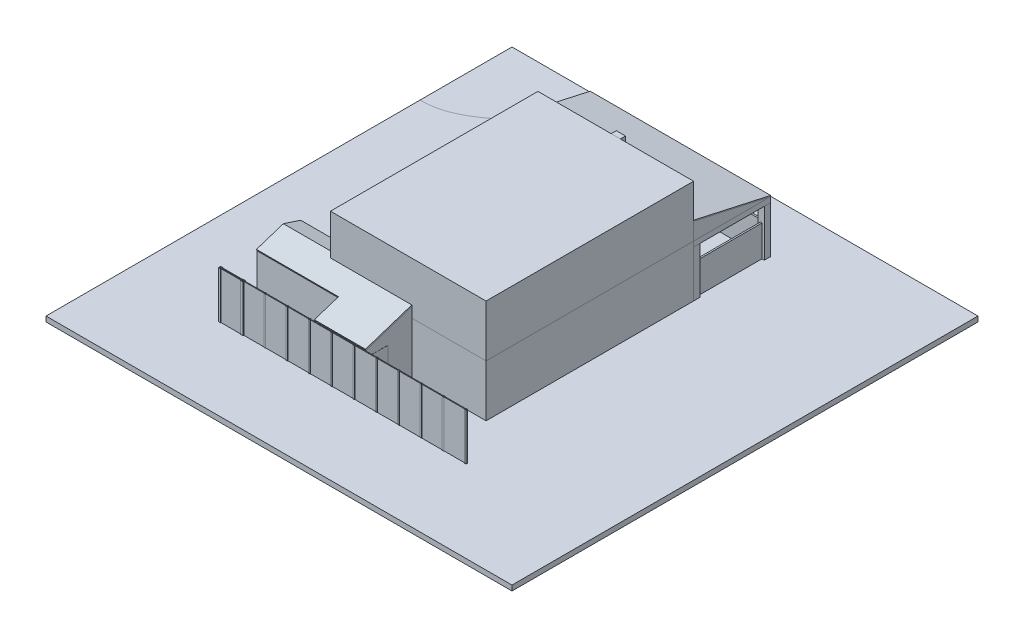
from build123d import *

# Parameters (mm, degrees)
SKETCH1_W                        = 15000
SKETCH1_H                        = 20000
BOSS_EXTRUDE1_DEPTH              = 5000
SKETCH18_W                       = 15000
SKETCH18_H                       = 20000
BOSS_EXTRUDE17_DEPTH             = 5000
BOSS_EXTRUDE23_DEPTH             = 500
EXTRUDE_THIN1_DEPTH              = 4500
EXTRUDE_THIN1_2_DEPTH            = 4500
SKETCH13_W                       = 44914.669786522
SKETCH13_H                       = 44914.669786522
BOSS_EXTRUDE15_DEPTH             = 500
BOSS_EXTRUDE16_DEPTH             = 500
CUT_EXTRUDE2_DEPTH               = 500
SKETCH19_W                       = 600
SKETCH19_H                       = 600
BOSS_EXTRUDE18_DEPTH             = 4500
BOSS_EXTRUDE18_2_DEPTH           = 4500
BOSS_EXTRUDE18_3_DEPTH           = 4500
BOSS_EXTRUDE18_4_DEPTH           = 4500
BOSS_EXTRUDE18_5_DEPTH           = 4500
BOSS_EXTRUDE18_6_DEPTH           = 4500
SKETCH25_W                       = 5000
SKETCH25_H                       = 150
BOSS_EXTRUDE24_DEPTH             = 3000
BOSS_EXTRUDE24_2_DEPTH           = 3000
BOSS_EXTRUDE24_3_DEPTH           = 3000
SKETCH25_W_2                     = 150
SKETCH25_H_2                     = 6215.075908171
BOSS_EXTRUDE24_4_DEPTH           = 3000
BOSS_EXTRUDE19_DEPTH             = 500
BOSS_EXTRUDE20_REACH             = 33298.603
BOSS_EXTRUDE20_DIRECTION_2_REACH = 33298.603
BOSS_EXTRUDE22_DEPTH             = 100
BOSS_EXTRUDE25_DEPTH             = 4500
BOSS_EXTRUDE26_DEPTH             = 4923.896568432
BOSS_EXTRUDE27_DEPTH             = 2920.430143306
BOSS_EXTRUDE28_DEPTH             = 4982.302916929
BOSS_EXTRUDE31_REACH             = 32234.185
SKETCH31_W                       = 200
SKETCH31_H                       = 4425
BOSS_EXTRUDE32_REACH             = 32234.185
BOSS_EXTRUDE33_DEPTH             = 10
BOSS_EXTRUDE33_DEPTH_BACK        = 210
SKETCH33_W                       = 1629.168946947
SKETCH33_H                       = 3889.531779121
SKETCH34_W                       = 1916.861309311
SKETCH34_H                       = 1466.865342486
CUT_EXTRUDE3_DEPTH               = 341


# Read off the part's stored shape, not the designer's step: Extrude-Thin1
with BuildPart() as part:
    # Sketch1 → Boss-Extrude1 (new body)
    with BuildSketch(Plane(origin=(0, 0, 0), x_dir=(1, 0, 0), z_dir=(0, 1, 0))):
        Rectangle(SKETCH1_W, SKETCH1_H)
    extrude(amount=BOSS_EXTRUDE1_DEPTH)


with BuildPart() as body_2:
    # Sketch18 → Boss-Extrude17 (new body)
    with BuildSketch(Plane(origin=(0, 5000, 0), x_dir=(1, 0, 0), z_dir=(0, 1, 0))):
        Rectangle(SKETCH18_W, SKETCH18_H)
    extrude(amount=BOSS_EXTRUDE17_DEPTH)



with BuildPart() as body_3:
    # Sketch24 → Boss-Extrude23 (new body)
    with BuildSketch(Plane(origin=(0, 0, -10000), x_dir=(-1, 0, 0), z_dir=(0, 0, -1))):
        Polygon((-1037.06837073, 0), (1037.06837073, 0), (1037.06837073, 5000), (443.459320269, 5593.609050461), (443.459320269, 10000), (-443.459320269, 10000), (-443.459320269, 5593.609050461), (-1037.06837073, 5000), align=None)
    extrude(amount=BOSS_EXTRUDE23_DEPTH)


with BuildPart() as body_4:
    # Extrude-Thin1 outline → Extrude-Thin1 (new body)
    with BuildSketch(Plane(origin=(0, 0, 0), x_dir=(1, 0, 0), z_dir=(0, 1, 0))):
        Polygon((-9350, -14462.5), (-11350, -14462.5), (-11350, -14498), (-9314.5, -14498), (-9314.5, -14460.5), (-9235.5, -14460.5), (-9235.5, -14498), (-7164.5, -14498), (-7164.5, -14460.5), (-7085.5, -14460.5), (-7085.5, -14498), (-5014.5, -14498), (-5014.5, -14460.5), (-4935.5, -14460.5), (-4935.5, -14498), (-2864.5, -14498), (-2864.5, -14460.5), (-2785.5, -14460.5), (-2785.5, -14498), (-714.5, -14498), (-714.5, -14460.5), (-635.5, -14460.5), (-635.5, -14498), (1435.5, -14498), (1435.5, -14460.5), (1514.5, -14460.5), (1514.5, -14498), (3585.5, -14498), (3585.5, -14460.5), (3664.5, -14460.5), (3664.5, -14498), (5735.5, -14498), (5735.5, -14460.5), (5814.5, -14460.5), (5814.5, -14498), (7885.5, -14498), (7885.5, -14460.5), (7964.5, -14460.5), (7964.5, -14498), (10035.5, -14498), (10035.5, -14460.5), (10114.5, -14460.5), (10114.5, -14539.5), (10035.5, -14539.5), (10035.5, -14502), (7964.5, -14502), (7964.5, -14539.5), (7885.5, -14539.5), (7885.5, -14502), (5814.5, -14502), (5814.5, -14539.5), (5735.5, -14539.5), (5735.5, -14502), (3664.5, -14502), (3664.5, -14539.5), (3585.5, -14539.5), (3585.5, -14502), (1514.5, -14502), (1514.5, -14539.5), (1435.5, -14539.5), (1435.5, -14502), (-635.5, -14502), (-635.5, -14539.5), (-714.5, -14539.5), (-714.5, -14502), (-2785.5, -14502), (-2785.5, -14539.5), (-2864.5, -14539.5), (-2864.5, -14502), (-4935.5, -14502), (-4935.5, -14539.5), (-5014.5, -14539.5), (-5014.5, -14502), (-7085.5, -14502), (-7085.5, -14539.5), (-7164.5, -14539.5), (-7164.5, -14502), (-9235.5, -14502), (-9235.5, -14539.5), (-9314.5, -14539.5), (-9314.5, -14502), (-11350, -14502), (-11350, -14537.5), (-9350, -14537.5), (-9350, -14575), (-9200, -14575), (-9200, -14537.5), (-7200, -14537.5), (-7200, -14575), (-7050, -14575), (-7050, -14537.5), (-5050, -14537.5), (-5050, -14575), (-4900, -14575), (-4900, -14537.5), (-2900, -14537.5), (-2900, -14575), (-2750, -14575), (-2750, -14537.5), (-750, -14537.5), (-750, -14575), (-600, -14575), (-600, -14537.5), (1400, -14537.5), (1400, -14575), (1550, -14575), (1550, -14537.5), (3550, -14537.5), (3550, -14575), (3700, -14575), (3700, -14537.5), (5700, -14537.5), (5700, -14575), (5850, -14575), (5850, -14537.5), (7850, -14537.5), (7850, -14575), (8000, -14575), (8000, -14537.5), (10000, -14537.5), (10000, -14575), (10150, -14575), (10150, -14425), (10000, -14425), (10000, -14462.5), (8000, -14462.5), (8000, -14425), (7850, -14425), (7850, -14462.5), (5850, -14462.5), (5850, -14425), (5700, -14425), (5700, -14462.5), (3700, -14462.5), (3700, -14425), (3550, -14425), (3550, -14462.5), (1550, -14462.5), (1550, -14425), (1400, -14425), (1400, -14462.5), (-600, -14462.5), (-600, -14425), (-750, -14425), (-750, -14462.5), (-2750, -14462.5), (-2750, -14425), (-2900, -14425), (-2900, -14462.5), (-4900, -14462.5), (-4900, -14425), (-5050, -14425), (-5050, -14462.5), (-7050, -14462.5), (-7050, -14425), (-7200, -14425), (-7200, -14462.5), (-9200, -14462.5), (-9200, -14425), (-9350, -14425), align=None)
    extrude(amount=EXTRUDE_THIN1_DEPTH)


with BuildPart() as body_5:
    # Extrude-Thin1 2 outline → Extrude-Thin1 2 (new body)
    with BuildSketch(Plane(origin=(0, 0, 0), x_dir=(1, 0, 0), z_dir=(0, 1, 0))):
        Polygon((-11350, -14425), (-11350, -14462.5), (-11314.5, -14462.5), (-11314.5, -14389.5), (-11535.5, -14389.5), (-11535.5, -14427), (-13464.5, -14427), (-13464.5, -14389.5), (-13685.5, -14389.5), (-13685.5, -14610.5), (-13464.5, -14610.5), (-13464.5, -14573), (-11535.5, -14573), (-11535.5, -14610.5), (-11314.5, -14610.5), (-11314.5, -14537.5), (-11350, -14537.5), (-11350, -14575), (-11500, -14575), (-11500, -14537.5), (-13500, -14537.5), (-13500, -14575), (-13650, -14575), (-13650, -14425), (-13500, -14425), (-13500, -14462.5), (-11500, -14462.5), (-11500, -14425), align=None)
    extrude(amount=EXTRUDE_THIN1_2_DEPTH)


with BuildPart() as body_6:
    # Sketch13 → Boss-Extrude15 (new body)
    with BuildSketch(Plane(origin=(0, 0, 0), x_dir=(1, 0, 0), z_dir=(0, 1, 0))):
        Rectangle(SKETCH13_W, SKETCH13_H)
    extrude(amount=-BOSS_EXTRUDE15_DEPTH)

    # Sketch17 → Cut-Extrude2 (cut)
    with BuildSketch(Plane(origin=(0, 0, 0), x_dir=(1, 0, 0), z_dir=(0, 1, 0))):
        with BuildLine():
            Line((-9417.596595329, 19912.914486274), (253.16202151, 19912.914486274))
            Line((253.16202151, 19912.914486274), (253.16202151, 22457.334893261))
            Line((253.16202151, 22457.334893261), (-22457.334893261, 22457.334893261))
            Line((-22457.334893261, 22457.334893261), (-22457.334893261, 13580.491726715))
            add(Edge.make_bspline(
                [(-22457.334893261, 13580.491726715), (-17070.908883704, 13536.391631527), (-14927.238931581, 19847.930276605), (-9417.596595329, 19912.914486274)],
                knots=[0, 0, 0, 0, 1, 1, 1, 1], degree=3))
        make_face()
    extrude(amount=-CUT_EXTRUDE2_DEPTH, mode=Mode.SUBTRACT)


with BuildPart() as body_7:
    # Sketch15 → Boss-Extrude16 (new body)
    with BuildSketch(Plane(origin=(0, 0, 0), x_dir=(1, 0, 0), z_dir=(0, 1, 0))):
        with BuildLine():
            Line((-22457.334893261, 13580.491726715), (-22457.334893261, 22457.334893261))
            Line((-22457.334893261, 22457.334893261), (253.16202151, 22457.334893261))
            Line((253.16202151, 22457.334893261), (253.16202151, 19912.914486274))
            Line((253.16202151, 19912.914486274), (-9417.596595329, 19912.914486274))
            add(Edge.make_bspline(
                [(-22457.334893261, 13580.491726715), (-17070.908883704, 13536.391631527), (-14927.238931581, 19847.930276605), (-9417.596595329, 19912.914486274)],
                knots=[0, 0, 0, 0, 1, 1, 1, 1], degree=3))
        make_face()
    extrude(amount=-BOSS_EXTRUDE16_DEPTH)


with BuildPart() as body_8:
    # Sketch19 → Boss-Extrude18 (new body)
    with BuildSketch(Plane(origin=(0, 0, 0), x_dir=(1, 0, 0), z_dir=(0, 1, 0))):
        with Locations((-9600, 10300)):
            Rectangle(SKETCH19_W, SKETCH19_H)
    extrude(amount=BOSS_EXTRUDE18_DEPTH)


with BuildPart() as body_9:
    # Sketch19 → Boss-Extrude18 2 (new body)
    with BuildSketch(Plane(origin=(0, 0, 0), x_dir=(1, 0, 0), z_dir=(0, 1, 0))):
        with Locations((-9600, 17115.075908171)):
            Rectangle(SKETCH19_W, SKETCH19_H)
    extrude(amount=BOSS_EXTRUDE18_2_DEPTH)


with BuildPart() as body_10:
    # Sketch19 → Boss-Extrude18 3 (new body)
    with BuildSketch(Plane(origin=(0, 0, 0), x_dir=(1, 0, 0), z_dir=(0, 1, 0))):
        with Locations((-4000, 17115.075908171)):
            Rectangle(SKETCH19_W, SKETCH19_H)
    extrude(amount=BOSS_EXTRUDE18_3_DEPTH)


with BuildPart() as body_11:
    # Sketch19 → Boss-Extrude18 4 (new body)
    with BuildSketch(Plane(origin=(0, 0, 0), x_dir=(1, 0, 0), z_dir=(0, 1, 0))):
        with Locations((1600, 17115.075908171)):
            Rectangle(SKETCH19_W, SKETCH19_H)
    extrude(amount=BOSS_EXTRUDE18_4_DEPTH)


with BuildPart() as body_12:
    # Sketch19 → Boss-Extrude18 5 (new body)
    with BuildSketch(Plane(origin=(0, 0, 0), x_dir=(1, 0, 0), z_dir=(0, 1, 0))):
        with Locations((7200, 17115.075908171)):
            Rectangle(SKETCH19_W, SKETCH19_H)
    extrude(amount=BOSS_EXTRUDE18_5_DEPTH)


with BuildPart() as body_13:
    # Sketch19 → Boss-Extrude18 6 (new body)
    with BuildSketch(Plane(origin=(0, 0, 0), x_dir=(1, 0, 0), z_dir=(0, 1, 0))):
        with Locations((7200, 10300)):
            Rectangle(SKETCH19_W, SKETCH19_H)
    extrude(amount=BOSS_EXTRUDE18_6_DEPTH)


with BuildPart() as body_14:
    # Sketch25 → Boss-Extrude24 (new body)
    with BuildSketch(Plane(origin=(0, 0, 0), x_dir=(1, 0, 0), z_dir=(0, 1, 0))):
        with Locations((-6800, 17115.075908171)):
            Rectangle(SKETCH25_W, SKETCH25_H)
    extrude(amount=BOSS_EXTRUDE24_DEPTH)


with BuildPart() as body_15:
    # Sketch25 → Boss-Extrude24 2 (new body)
    with BuildSketch(Plane(origin=(0, 0, 0), x_dir=(1, 0, 0), z_dir=(0, 1, 0))):
        with Locations((-1200, 17115.075908171)):
            Rectangle(SKETCH25_W, SKETCH25_H)
    extrude(amount=BOSS_EXTRUDE24_2_DEPTH)


with BuildPart() as body_16:
    # Sketch25 → Boss-Extrude24 3 (new body)
    with BuildSketch(Plane(origin=(0, 0, 0), x_dir=(1, 0, 0), z_dir=(0, 1, 0))):
        with Locations((4400, 17115.075908171)):
            Rectangle(SKETCH25_W, SKETCH25_H)
    extrude(amount=BOSS_EXTRUDE24_3_DEPTH)


with BuildPart() as body_17:
    # Sketch25 → Boss-Extrude24 4 (new body)
    with BuildSketch(Plane(origin=(0, 0, 0), x_dir=(1, 0, 0), z_dir=(0, 1, 0))):
        with Locations((7200, 13707.537954086)):
            Rectangle(SKETCH25_W_2, SKETCH25_H_2)
    extrude(amount=BOSS_EXTRUDE24_4_DEPTH)


with BuildPart() as body_18:
    # Sketch20 → Boss-Extrude19 (new body)
    with BuildSketch(Plane(origin=(0, 4500, 0), x_dir=(1, 0, 0), z_dir=(0, 1, 0))):
        Polygon((7500, 10000), (7500, 17415.075908171), (-9900, 17415.075908171), (-9900, 10000), (-1037.06837073, 10000), (-1037.06837073, 10500), (1037.06837073, 10500), (1037.06837073, 10000), align=None)
    extrude(amount=BOSS_EXTRUDE19_DEPTH)


with BuildPart() as body_19:

    # Boss-Extrude20: up to this face of the body (flat: up to its plane)
    boss_extrude20_end = Plane(body_18.part.faces().sort_by_distance((-9900, 4750, -13707.537954085))[0])
    # Sketch21 → Boss-Extrude20 (new, up to the picked face)
    with BuildSketch(Plane(origin=(0, 0, 0), x_dir=(0, 0, -1), z_dir=(1, 0, 0)), mode=Mode.PRIVATE) as boss_extrude20_sk1:
        Polygon((17415.075908171, 5000), (10000, 6643.882751934), (10000, 5000), align=None)
    boss_extrude20_tool1 = split(extrude(boss_extrude20_sk1.sketch, amount=-BOSS_EXTRUDE20_REACH, mode=Mode.PRIVATE), bisect_by=boss_extrude20_end, keep=Keep.BOTH, mode=Mode.PRIVATE)
    add(boss_extrude20_tool1.solids().sort_by(Axis((0, 5547.960917, -12471.691969), (-1, 0, 0)))[0])


    # Boss-Extrude20 direction 2: up to this face of the body (flat: up to its plane)
    boss_extrude20_direction_2_end = Plane(body_18.part.faces().sort_by_distance((7500, 4750, -13707.537954085))[0])
    # Sketch21 → Boss-Extrude20 direction 2 (add, up to the picked face)
    with BuildSketch(Plane(origin=(0, 0, 0), x_dir=(0, 0, -1), z_dir=(1, 0, 0)), mode=Mode.PRIVATE) as boss_extrude20_direction_2_sk1:
        Polygon((17415.075908171, 5000), (10000, 6643.882751934), (10000, 5000), align=None)
    boss_extrude20_direction_2_tool1 = split(extrude(boss_extrude20_direction_2_sk1.sketch, amount=BOSS_EXTRUDE20_DIRECTION_2_REACH, mode=Mode.PRIVATE), bisect_by=boss_extrude20_direction_2_end, keep=Keep.BOTH, mode=Mode.PRIVATE)
    add(boss_extrude20_direction_2_tool1.solids().sort_by(Axis((0, 5547.960917, -12471.691969), (1, 0, 0)))[0])


with BuildPart() as body_20:
    # Sketch23 → Boss-Extrude22 (new body)
    with BuildSketch(Plane(origin=(0, 8445.734021788, -1872.374154732), x_dir=(1, 0, 0), z_dir=(0, 0.9762960071199333, -0.21643961393810338))):
        Polygon((-9900, 15920.071003147), (7500, 15920.071003147), (7500, 8324.960653321), (443.459320269, 8324.960653321), (443.459320269, 8837.100410478), (-443.459320269, 8837.100410478), (-443.459320269, 8324.960653321), (-9900, 8324.960653321), align=None)
    extrude(amount=BOSS_EXTRUDE22_DEPTH)


with BuildPart() as body_21:
    # Sketch26 → Boss-Extrude25 (new body)
    with BuildSketch(Plane(origin=(0, 0, 0), x_dir=(1, 0, 0), z_dir=(0, 1, 0))):
        Polygon((-7500, -7928.527067686), (-7500, -8128.527067686), (-12282.302916929, -8128.527067686), (-12282.302916929, -11903.413636673), (-4379.569856694, -11903.413636673), (-4379.569856694, -14225), (144.326711738, -14225), (144.326711738, -10000), (344.326711738, -10000), (344.326711738, -14425), (-4579.569856694, -14425), (-4579.569856694, -12103.413636673), (-12482.302916929, -12103.413636673), (-12482.302916929, -7928.527067686), align=None)
    extrude(amount=BOSS_EXTRUDE25_DEPTH)



with BuildPart() as body_22:
    # Sketch27 → Boss-Extrude26 (new body)
    with BuildSketch(Plane(origin=(344.326711738, 0, 0), x_dir=(0, 0, -1), z_dir=(1, 0, 0))):
        Polygon((-14425, 4500), (-10000, 5947.185193665), (-10000, 6097.525015869), (-14469.417377488, 4635.813229878), align=None)
    extrude(amount=-BOSS_EXTRUDE26_DEPTH)

    # Sketch28 → Boss-Extrude27 (add)
    with BuildSketch(Plane.ZY.offset(4579.569856694)):
        Polygon((12103.413636673, 5259.269019395), (12147.831014161, 5395.082249272), (10000, 6097.525015869), (10000, 5947.185193665), align=None)
    extrude(amount=BOSS_EXTRUDE27_DEPTH)


with BuildPart() as body_2_1:
    add(body_2.part)

    add(body_22.part)  # Boss-Extrude28 merges body 22
    # Sketch30 → Boss-Extrude28 (add)
    with BuildSketch(Plane.ZY.offset(7500)):
        Polygon((7884.109690198, 5696.023932711), (9555.881707324, 6242.772793811), (12147.831014161, 5395.082249272), (12103.413636673, 5259.269019395), (9555.881707324, 6092.432971608), (7928.527067686, 5560.210702833), align=None)
    extrude(amount=BOSS_EXTRUDE28_DEPTH)


with BuildPart() as body_21_1:
    add(body_21.part)

    # Boss-Extrude31: up to this face of the body (flat: up to its plane)
    boss_extrude31_end = Plane(body_2_1.part.faces().sort_by_distance((-5170.734727105, 5422.3035037, 11604.909646854))[0])
    # Sketch31 → Boss-Extrude31 (add, up to the picked face)
    with BuildSketch(Plane(origin=(0, 4500, 0), x_dir=(1, 0, 0), z_dir=(0, 1, 0)), mode=Mode.PRIVATE) as boss_extrude31_sk1:
        with Locations((244.326711738, -12212.5)):
            Rectangle(SKETCH31_W, SKETCH31_H)
    boss_extrude31_tool1 = split(extrude(boss_extrude31_sk1.sketch, amount=BOSS_EXTRUDE31_REACH, mode=Mode.PRIVATE), bisect_by=boss_extrude31_end, keep=Keep.BOTH, mode=Mode.PRIVATE)
    # Sketch31 → Boss-Extrude31 (add, up to the picked face)
    with BuildSketch(Plane(origin=(0, 4500, 0), x_dir=(1, 0, 0), z_dir=(0, 1, 0)), mode=Mode.PRIVATE) as boss_extrude31_sk2:
        Polygon((-12482.302916929, -9555.881707324), (-12482.302916929, -12103.413636673), (-4579.569856694, -12103.413636673), (-4579.569856694, -14425), (-4379.569856694, -14425), (-4379.569856694, -11903.413636673), (-12282.302916929, -11903.413636673), (-12282.302916929, -9555.881707324), align=None)
    boss_extrude31_tool2 = split(extrude(boss_extrude31_sk2.sketch, amount=BOSS_EXTRUDE31_REACH, mode=Mode.PRIVATE), bisect_by=boss_extrude31_end, keep=Keep.BOTH, mode=Mode.PRIVATE)
    add(boss_extrude31_tool1.solids().sort_by(Axis((244.326712, 4500, 12212.5), (0, 1, 0)))[0])
    add(boss_extrude31_tool2.solids().sort_by(Axis((-8438.963449, 4500, 11998.467916), (0, 1, 0)))[0])


    # Boss-Extrude32: up to this face of the body (flat: up to its plane)
    boss_extrude32_end = Plane(body_2_1.part.faces().sort_by_distance((-9991.151458465, 5826.321837221, 8742.204387505))[0])
    # Sketch32 → Boss-Extrude32 (add, up to the picked face)
    with BuildSketch(Plane(origin=(0, 4500, 0), x_dir=(1, 0, 0), z_dir=(0, 1, 0)), mode=Mode.PRIVATE) as boss_extrude32_sk1:
        Polygon((-12282.302916929, -9555.881707324), (-12482.302916929, -9555.881707324), (-12482.302916929, -7928.527067686), (-7500, -7928.527067686), (-7500, -8128.527067686), (-12282.302916929, -8128.527067686), align=None)
    boss_extrude32_tool1 = split(extrude(boss_extrude32_sk1.sketch, amount=BOSS_EXTRUDE32_REACH, mode=Mode.PRIVATE), bisect_by=boss_extrude32_end, keep=Keep.BOTH, mode=Mode.PRIVATE)
    add(boss_extrude32_tool1.solids().sort_by(Axis((-12382.302917, 4500, 9503.468326), (0, 1, 0)))[0])

    # Sketch34 → Cut-Extrude3 (cut)
    with BuildSketch(Plane.ZY.offset(4579.569856694)):
        with Locations((13158.086485858, 2811.422709851)):
            Rectangle(SKETCH34_W, SKETCH34_H)
    extrude(amount=-CUT_EXTRUDE3_DEPTH, mode=Mode.SUBTRACT)


with BuildPart() as body_22_2:
    # Sketch33 → Boss-Extrude33 (new, two sides: drawn at the far end of the back side and taken through both)
    with BuildSketch(Plane(origin=(344.326711738, 0, 0), x_dir=(0, 0, -1), z_dir=(1, 0, 0)).offset(-BOSS_EXTRUDE33_DEPTH_BACK)):
        with Locations((-13103.616000958, 1944.765889561)):
            Rectangle(SKETCH33_W, SKETCH33_H)
    extrude(amount=BOSS_EXTRUDE33_DEPTH + BOSS_EXTRUDE33_DEPTH_BACK)


solid = Compound([part.part, body_3.part, body_4.part, body_5.part, body_6.part, body_7.part, body_8.part, body_9.part, body_10.part, body_11.part, body_12.part, body_13.part, body_14.part, body_15.part, body_16.part, body_17.part, body_18.part, body_19.part, body_20.part, body_2_1.part, body_21_1.part, body_22_2.part])
